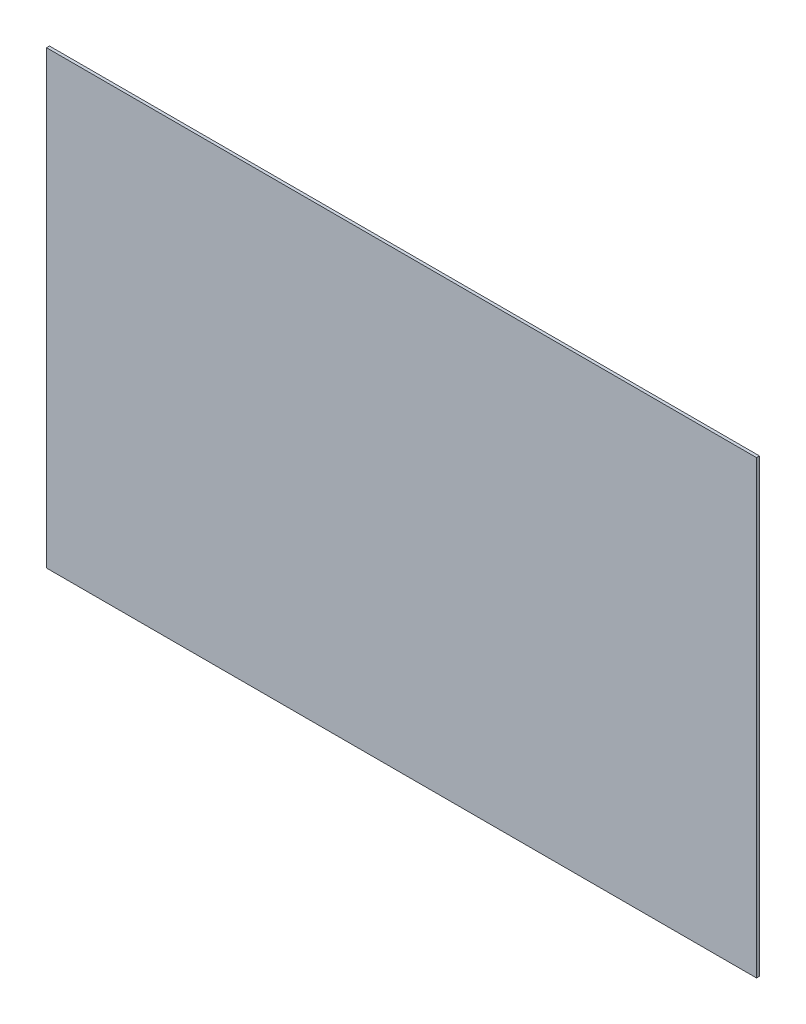
from build123d import *

# Parameters (mm, degrees)
SKETCH1_W           = 765
SKETCH1_H           = 485.6
BOSS_EXTRUDE1_DEPTH = 3.175


with BuildPart() as part:
    # Sketch1 → Boss-Extrude1 (new body)
    with BuildSketch(Plane.XY):
        Rectangle(SKETCH1_W, SKETCH1_H)
    extrude(amount=BOSS_EXTRUDE1_DEPTH)


solid = part.part
